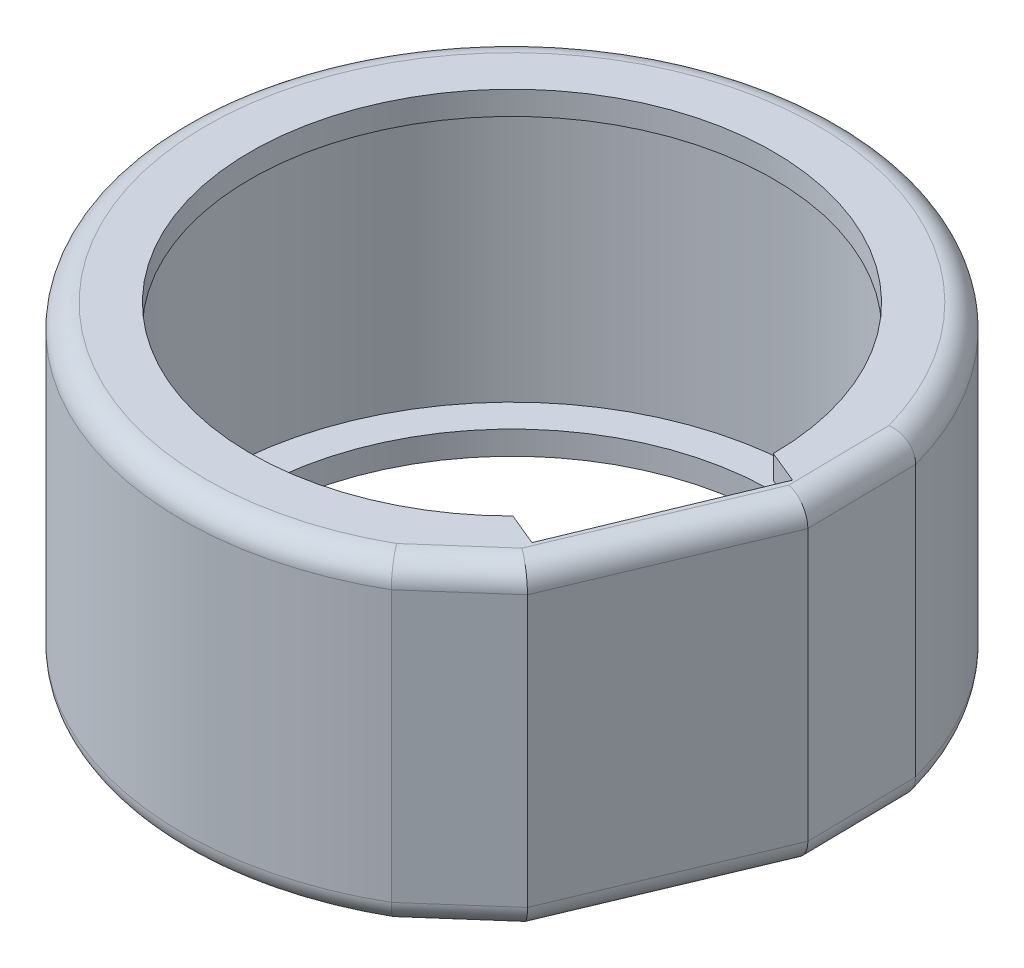
from build123d import *

# Parameters (mm, degrees)
EXTRUDE_1_DEPTH     = 1
EXTRUDE_START       = 11.5
EXTRUDE_3_DEPTH     = 11.5
EXTRUDE_START_2     = 1
EXTRUDE_4_DEPTH     = 1
FILLET_1_R          = 1
FILLET_2_R          = 1
SKETCH_7_W          = 8.471052631578948
SKETCH_7_H          = 1
CUT_EXTRUDE_1_DEPTH = 1.5
SKETCH2_R           = 0.8000000000000002
CUT_EXTRUDE1_DEPTH  = 10


with BuildPart() as part:
    # 草图1 → 凸台-拉伸1 (new body)
    with BuildSketch(Plane(origin=(0, 0, 0), x_dir=(1, 0, 0), z_dir=(0, 1, 0))):
        with BuildLine():
            Line((13.595707880639235, -1.030263157894738), (10.075971038533972, -9.418398712579371))
            Line((10.075971038533972, -9.418398712579371), (7, -12.12435565298214))
            ThreePointArc((7, -12.12435565298214), (-12.93431345515802, 5.357568053111247), (13.522961568046952, 3.6234666314353032))
            Line((13.522961568046952, 3.6234666314353032), (13.595707880639235, -1.030263157894738))
        make_face()
        with BuildLine():
            Line((11.1, 0), (7.867624653739615, -7.830101040718992))
            ThreePointArc((7.867624653739615, -7.830101040718992), (-10.260132398183506, 4.235526315789474), (11.1, 0))
        make_face(mode=Mode.SUBTRACT)
    extrude(amount=EXTRUDE_1_DEPTH)

    # 草图2 → 凸台-拉伸3 (add)
    with BuildSketch(Plane(origin=(0, 0, 0), x_dir=(-1, 0, 0), z_dir=(0, -1, 0)).offset(EXTRUDE_START)):
        with BuildLine():
            Line((-13.595707880639234, -1.030263157894738), (-13.52296156804698, 3.6234666314351993))
            ThreePointArc((-13.52296156804698, 3.6234666314351993), (12.934313455157998, 5.357568053111296), (-7, -12.12435565298214))
            Line((-7, -12.12435565298214), (-10.07597103853397, -9.418398712579371))
            Line((-10.07597103853397, -9.418398712579371), (-13.595707880639234, -1.030263157894738))
        make_face()
        with BuildLine():
            Line((-9.226675534749763, -8.43317606696612), (-12.487400822321415, -0.5610888545377466))
            ThreePointArc((-12.487400822321415, -0.5610888545377466), (11.548494156391081, 4.783542904563626), (-9.226675534749763, -8.43317606696612))
        make_face(mode=Mode.SUBTRACT)
    extrude(amount=-EXTRUDE_3_DEPTH)

    # 草图5 → 凸台-拉伸4 (add)
    with BuildSketch(Plane(origin=(0, -11.5, 0), x_dir=(-1, 0, 0), z_dir=(0, -1, 0)).offset(EXTRUDE_START_2)):
        with BuildLine():
            Line((-13.522961568046979, 3.6234666314352), (-13.595707880639234, -1.030263157894738))
            Line((-13.595707880639234, -1.030263157894738), (-10.07597103853397, -9.418398712579371))
            Line((-10.07597103853397, -9.418398712579371), (-7.0000000000000115, -12.124355652982132))
            ThreePointArc((-7.0000000000000115, -12.124355652982132), (12.934313455157996, 5.3575680531112955), (-13.522961568046979, 3.6234666314352))
        make_face()
        with BuildLine():
            Line((-11.099999999999998, 0), (-7.867624653739613, -7.830101040718992))
            ThreePointArc((-7.867624653739613, -7.830101040718992), (10.260132398183506, 4.235526315789473), (-11.099999999999998, 0))
        make_face(mode=Mode.SUBTRACT)
    extrude(amount=-EXTRUDE_4_DEPTH)

    # 圆角1
    # the kernel refuses this fillet: 1 mm, written as the material it takes off along each edge
    with BuildSketch(Plane(origin=(11.953026446892592, -12.5, 7.767137681139568), x_dir=(-0.6605044125759219, 0, -0.7508221633434488), z_dir=(-0.7508221633434488, 0, 0.6605044125759219))) as fillet_1_piece_1:
        with BuildLine():
            CenterArc((FILLET_1_R, -FILLET_1_R), FILLET_1_R, 90, 90)
            Line((-1.17e-15, -FILLET_1_R), (0, 0))
            Line((0, 0), (FILLET_1_R, 0))
        make_face()
    extrude(amount=9.096803728910325, mode=Mode.SUBTRACT)
    with BuildSketch(Plane(origin=(1.33e-15, -12.5, -1.33e-15), x_dir=(0.6464264276811541, 0, 0.7629763257109501), z_dir=(0.7629763257109501, 0, -0.6464264276811541))) as fillet_1_piece_2:
        with BuildLine():
            CenterArc((14.000000000000002 - FILLET_1_R, -FILLET_1_R), FILLET_1_R, 0, 89.9999999999999)
            Line((14.000000000000002 - FILLET_1_R, 0), (14.000000000000002, 0))
            Line((14.000000000000002, 0), (14.000000000000002, -FILLET_1_R))
        make_face()
    revolve(axis=Axis((1.33e-15, -12.5, -1.33e-15), (0, -1, 0)), revolution_arc=305.54541710396313, mode=Mode.SUBTRACT)
    with BuildSketch(Plane(origin=(13.483886766982303, -12.5, -6.123161244767347), x_dir=(-1e-17, 1, 0), z_dir=(0.015629920425854232, 0, 0.9998778453328594))) as fillet_1_piece_3:
        with BuildLine():
            CenterArc((FILLET_1_R, FILLET_1_R), FILLET_1_R, 180, 90)
            Line((1e-17, FILLET_1_R), (0, 0))
            Line((0, 0), (FILLET_1_R, 0))
        make_face()
    extrude(amount=9.654298333593651, mode=Mode.SUBTRACT)
    with BuildSketch(Plane(origin=(14.563022756193803, -12.5, -1.275013817119511), x_dir=(9.6e-16, 1, 4e-16), z_dir=(-0.386925950221828, 0, 0.9221107900056997))) as fillet_1_piece_4:
        with BuildLine():
            CenterArc((FILLET_1_R, FILLET_1_R), FILLET_1_R, 180, 90.00000000000006)
            Line((-1.04e-15, FILLET_1_R), (0, 0))
            Line((0, 0), (FILLET_1_R, 0))
        make_face()
    extrude(amount=14.0966678251675, mode=Mode.SUBTRACT)

    # 圆角2
    # the kernel refuses this fillet: 1 mm, written as the material it takes off along each edge
    with BuildSketch(Plane(origin=(13.483886766982302, 1, -6.123161244767451), x_dir=(-1e-17, -1, 0), z_dir=(0.01562992042585999, 0, 0.9998778453328593))) as fillet_2_piece_1:
        with BuildLine():
            CenterArc((FILLET_2_R, -FILLET_2_R), FILLET_2_R, 90, 90)
            Line((1e-17, -FILLET_2_R), (0, 0))
            Line((0, 0), (FILLET_2_R, 0))
        make_face()
    extrude(amount=9.654298333593754, mode=Mode.SUBTRACT)
    with BuildSketch(Plane(origin=(-1.19e-15, 1, 1.55e-15), x_dir=(0.6464264276811535, 0, 0.7629763257109505), z_dir=(0.7629763257109505, 0, -0.6464264276811535))) as fillet_2_piece_2:
        with BuildLine():
            CenterArc((14.000000000000002 - FILLET_2_R, FILLET_2_R), FILLET_2_R, 270, 90)
            Line((14.000000000000002 - FILLET_2_R, 0), (14.000000000000002, 0))
            Line((14.000000000000002, 0), (14.000000000000002, FILLET_2_R))
        make_face()
    revolve(axis=Axis((-1.19e-15, 1, 1.55e-15), (0, -1, 0)), revolution_arc=305.54541710396273, mode=Mode.SUBTRACT)
    with BuildSketch(Plane(origin=(11.953026446892594, 1, 7.767137681139568), x_dir=(-0.6605044125759215, 0, -0.7508221633434492), z_dir=(-0.7508221633434492, 0, 0.6605044125759215))) as fillet_2_piece_3:
        with BuildLine():
            CenterArc((FILLET_2_R, FILLET_2_R), FILLET_2_R, 180, 90)
            Line((6.7e-16, FILLET_2_R), (0, 0))
            Line((0, 0), (FILLET_2_R, 0))
        make_face()
    extrude(amount=9.096803728910341, mode=Mode.SUBTRACT)
    with BuildSketch(Plane(origin=(14.563022756193805, 1, -1.2750138171195122), x_dir=(-0.9221107900056996, 0, -0.38692595022182796), z_dir=(-0.386925950221828, 0, 0.9221107900056997))) as fillet_2_piece_4:
        with BuildLine():
            CenterArc((FILLET_2_R, FILLET_2_R), FILLET_2_R, 180, 90)
            Line((-1e-17, FILLET_2_R), (0, 0))
            Line((0, 0), (FILLET_2_R, 0))
        make_face()
    extrude(amount=14.096667825167504, mode=Mode.SUBTRACT)

    # 草图7 → 切除-拉伸1 (cut)
    with BuildSketch(Plane(origin=(9.483812326869804, 0, 3.915050520359493), x_dir=(-0.3815789473684208, 0, 0.9243362520886044), z_dir=(-0.9243362520886044, 0, -0.3815789473684208))):
        with Locations((2.66e-15, 0.5)):
            Rectangle(SKETCH_7_W, SKETCH_7_H)
    extrude(amount=-CUT_EXTRUDE_1_DEPTH, mode=Mode.SUBTRACT)

    # Sketch2 → Cut-Extrude1 (cut)
    with BuildSketch(Plane(origin=(-13.134678702914778, 0, 4.845638799084908), x_dir=(0.3461170570774934, 0, 0.938191335922484), z_dir=(-0.938191335922484, 0, 0.34611705707749346))):
        with Locations((0, -5.75)):
            Circle(SKETCH2_R)
    extrude(amount=-CUT_EXTRUDE1_DEPTH, mode=Mode.SUBTRACT)


solid = part.part
